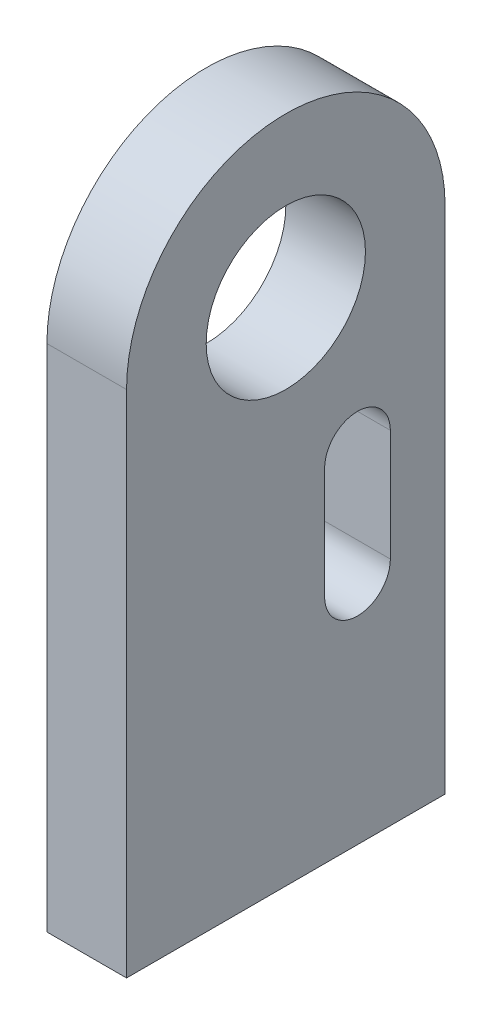
from build123d import *

# Parameters (mm, degrees)
BOSS_EXTRUDE1_DEPTH        = 5
F_10_0MM_DOWEL_HOLE1_D     = 10
F_10_0MM_DOWEL_HOLE1_DEPTH = 25
F_10_0MM_DOWEL_HOLE1_TIP   = 3.004303095
CUT_EXTRUDE1_DEPTH         = 10
M3_TAPPED_HOLE1_D          = 2.5
M3_TAPPED_HOLE1_DEPTH      = 8
M3_TAPPED_HOLE1_TIP        = 0.751075774


with BuildPart() as part:
    # Sketch1 → Boss-Extrude1 (new body)
    with BuildSketch(Plane(origin=(0, 0, 0), x_dir=(0, 0, -1), z_dir=(1, 0, 0))):
        with BuildLine():
            Line((10, 0), (-10, 0))
            Line((-10, 0), (-10, 32))
            ThreePointArc((-10, 32), (0, 42), (10, 32))
            Line((10, 32), (10, 0))
        make_face()
    extrude(amount=BOSS_EXTRUDE1_DEPTH)

    # Ø10.0mm Dowel Hole1
    with Locations(Plane(origin=(0, 32, 0), x_dir=(0, 0, -1), z_dir=(-1, 0, 0))):
        with Locations((0, 0)):
            Hole(F_10_0MM_DOWEL_HOLE1_D / 2, depth=F_10_0MM_DOWEL_HOLE1_DEPTH)
            with Locations((0, 0, -(F_10_0MM_DOWEL_HOLE1_DEPTH + F_10_0MM_DOWEL_HOLE1_TIP / 2))):  # 118° drill point
                Cone(0, F_10_0MM_DOWEL_HOLE1_D / 2, F_10_0MM_DOWEL_HOLE1_TIP, mode=Mode.SUBTRACT)

    # Sketch5 → Cut-Extrude1 (cut)
    with BuildSketch(Plane(origin=(5, 0, 0), x_dir=(0, 0, -1), z_dir=(1, 0, 0))):
        with BuildLine():
            Line((6.563643286, 21.5), (6.563643286, 14.5))
            ThreePointArc((6.563643286, 14.5), (4.5, 12.436356714), (2.436356714, 14.5))
            Line((2.436356714, 14.5), (2.436356714, 21.5))
            ThreePointArc((2.436356714, 21.5), (4.5, 23.563643286), (6.563643286, 21.5))
        make_face()
    extrude(amount=-CUT_EXTRUDE1_DEPTH, mode=Mode.SUBTRACT)

    # M3 Tapped Hole1
    with Locations(Plane(origin=(2.5, 0, 5), x_dir=(0, 0, -1), z_dir=(0, -1, 0))):
        with Locations((0, 0), (10, 0)):
            Hole(M3_TAPPED_HOLE1_D / 2, depth=M3_TAPPED_HOLE1_DEPTH)
            with Locations((0, 0, -(M3_TAPPED_HOLE1_DEPTH + M3_TAPPED_HOLE1_TIP / 2))):  # 118° drill point
                Cone(0, M3_TAPPED_HOLE1_D / 2, M3_TAPPED_HOLE1_TIP, mode=Mode.SUBTRACT)


solid = part.part
